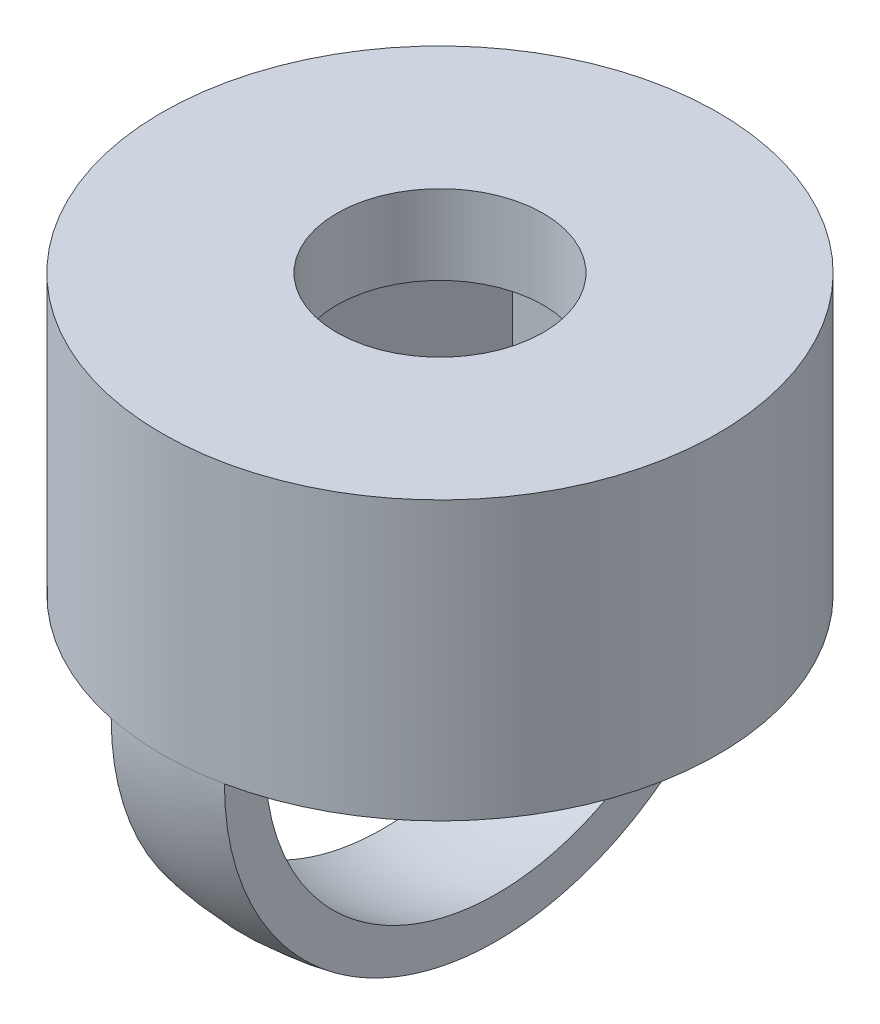
from build123d import *

# Parameters (mm, degrees)
SKETCH1_R           = 7
BOSS_EXTRUDE1_DEPTH = 5
SKETCH2_R           = 7
BOSS_EXTRUDE2_DEPTH = 2
SKETCH3_R           = 2.6
CUT_EXTRUDE1_DEPTH  = 2
SKETCH6_W           = 5.837661396
SKETCH6_H           = 14.272008298
SKETCH6_W_2         = 5.876709299
CUT_EXTRUDE2_DEPTH  = 8


with BuildPart() as part:
    # Sketch1 → Boss-Extrude1 (new body)
    with BuildSketch(Plane(origin=(0, 0, 0), x_dir=(1, 0, 0), z_dir=(0, 1, 0))):
        Circle(SKETCH1_R)
        Polygon((-2.5, 4.330127019), (2.5, 4.330127019), (5, 0), (2.5, -4.330127019), (-2.5, -4.330127019), (-5, 0), align=None, mode=Mode.SUBTRACT)
    extrude(amount=BOSS_EXTRUDE1_DEPTH)

    # Sketch2 → Boss-Extrude2 (add)
    with BuildSketch(Plane(origin=(0, 5, 0), x_dir=(1, 0, 0), z_dir=(0, 1, 0))):
        Circle(SKETCH2_R)
    extrude(amount=BOSS_EXTRUDE2_DEPTH)

    # Sketch3 → Cut-Extrude1 (cut)
    with BuildSketch(Plane.XZ.offset(-5)):
        Circle(SKETCH3_R)
    extrude(amount=-CUT_EXTRUDE1_DEPTH, mode=Mode.SUBTRACT)

    # Sketch5 → Revolve1 (revolve)
    with BuildSketch(Plane.XY):
        with BuildLine():
            Line((-7, 0), (-6, 0))
            ThreePointArc((-6, 0), (-4.242640687, -4.242640687), (0, -6))
            Line((0, -6), (0, -7))
            ThreePointArc((0, -7), (-4.949747468, -4.949747468), (-7, 0))
        make_face()
    revolve(axis=Axis((0, 5, 0), (0, -1, 0)))

    # Sketch6 → Cut-Extrude2 (cut)
    with BuildSketch(Plane(origin=(0, 0, 0), x_dir=(-1, 0, 0), z_dir=(0, -1, 0))):
        with Locations((4.344079133, 0)):
            Rectangle(SKETCH6_W, SKETCH6_H)
        with Locations((-4.363603085, 0)):
            Rectangle(SKETCH6_W_2, SKETCH6_H)
    extrude(amount=CUT_EXTRUDE2_DEPTH, mode=Mode.SUBTRACT)


solid = part.part
